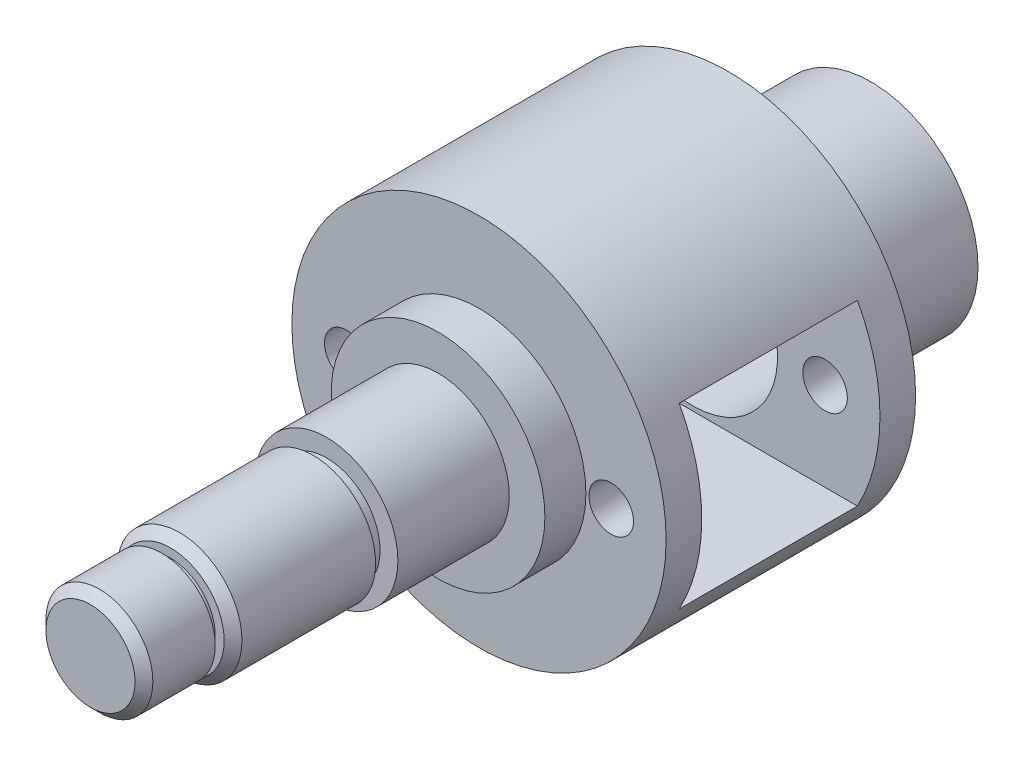
from build123d import *

# Parameters (mm, degrees)
ESQUISSE1_R             = 6
BOSS_EXTRU_1_DEPTH      = 8
ESQUISSE2_R             = 10.5
ESQUISSE2_R_2           = 1.25
BOSS_EXTRU_2_DEPTH      = 14
ESQUISSE3_R             = 6
BOSS_EXTRU_3_DEPTH      = 2.3
ESQUISSE4_R             = 4
BOSS_EXTRU_4_DEPTH      = 6.25
ESQUISSE5_R             = 3
BOSS_EXTRU_5_DEPTH      = 0.75
ESQUISSE7_R             = 3.5
BOSS_EXTRU_6_DEPTH      = 8
ESQUISSE8_R             = 2.5
BOSS_EXTRU_7_DEPTH      = 0.5
ESQUISSE9_R             = 3
BOSS_EXTRU_8_DEPTH      = 4
ESQUISSE10_R            = 4.75
ENL_V_MAT_EXTRU_1_DEPTH = 21
CHANFREIN1_SIZE         = 0.5
CHANFREIN2_SIZE         = 0.5
CUT_EXTRUDE1_DEPTH      = 12
CUT_EXTRUDE1_DEPTH_BACK = 12
SKETCH1_W               = 10
SKETCH1_H               = 10


with BuildPart() as part:
    # Esquisse1 → Boss.-Extru.1 (new body)
    with BuildSketch(Plane.XY):
        Circle(ESQUISSE1_R)
    extrude(amount=BOSS_EXTRU_1_DEPTH)

    # Esquisse2 → Boss.-Extru.2 (add)
    with BuildSketch(Plane.XY.offset(8)):
        Circle(ESQUISSE2_R)
        with Locations((-7.418567839, -0.026589849)):
            Circle(ESQUISSE2_R_2, mode=Mode.SUBTRACT)
        with Locations((7.418567839, -0.026589849)):
            Circle(ESQUISSE2_R_2, mode=Mode.SUBTRACT)
    extrude(amount=BOSS_EXTRU_2_DEPTH)

    # Esquisse3 → Boss.-Extru.3 (add)
    with BuildSketch(Plane.XY.offset(22)):
        Circle(ESQUISSE3_R)
    extrude(amount=BOSS_EXTRU_3_DEPTH)

    # Esquisse4 → Boss.-Extru.4 (add)
    with BuildSketch(Plane.XY.offset(24.3)):
        Circle(ESQUISSE4_R)
    extrude(amount=BOSS_EXTRU_4_DEPTH)

    # Esquisse5 → Boss.-Extru.5 (add)
    with BuildSketch(Plane.XY.offset(30.55)):
        Circle(ESQUISSE5_R)
    extrude(amount=BOSS_EXTRU_5_DEPTH)

    # Esquisse7 → Boss.-Extru.6 (add)
    with BuildSketch(Plane.XY.offset(31.3)):
        Circle(ESQUISSE7_R)
    extrude(amount=BOSS_EXTRU_6_DEPTH)

    # Esquisse8 → Boss.-Extru.7 (add)
    with BuildSketch(Plane.XY.offset(39.3)):
        Circle(ESQUISSE8_R)
    extrude(amount=BOSS_EXTRU_7_DEPTH)

    # Esquisse9 → Boss.-Extru.8 (add)
    with BuildSketch(Plane.XY.offset(39.8)):
        Circle(ESQUISSE9_R)
    extrude(amount=BOSS_EXTRU_8_DEPTH)

    # Esquisse10 → Enlèv. mat.-Extru.1 (cut)
    with BuildSketch(Plane(origin=(0, 0, 0), x_dir=(-1, 0, 0), z_dir=(0, 0, -1))):
        Circle(ESQUISSE10_R)
    extrude(amount=-ENL_V_MAT_EXTRU_1_DEPTH, mode=Mode.SUBTRACT)

    # Chanfrein1
    chanfrein1_edges = [part.edges().sort_by_distance(p)[0] for p in [
        (-3.5, 0, 39.3),
    ]]
    chamfer(chanfrein1_edges, length=CHANFREIN1_SIZE)

    # Chanfrein2
    chanfrein2_edges = [part.edges().sort_by_distance(p)[0] for p in [
        (-3, 0, 43.8),
    ]]
    chamfer(chanfrein2_edges, length=CHANFREIN2_SIZE)

    # Sketch1 → Cut-Extrude1 (cut, two sides: drawn at the far end of the back side and taken through both)
    with BuildSketch(Plane(origin=(0, 0, 0), x_dir=(0, 0, -1), z_dir=(1, 0, 0)).offset(-CUT_EXTRUDE1_DEPTH_BACK)):
        with Locations((-15, 0)):
            Rectangle(SKETCH1_W, SKETCH1_H)
    extrude(amount=CUT_EXTRUDE1_DEPTH + CUT_EXTRUDE1_DEPTH_BACK, mode=Mode.SUBTRACT)


solid = part.part
